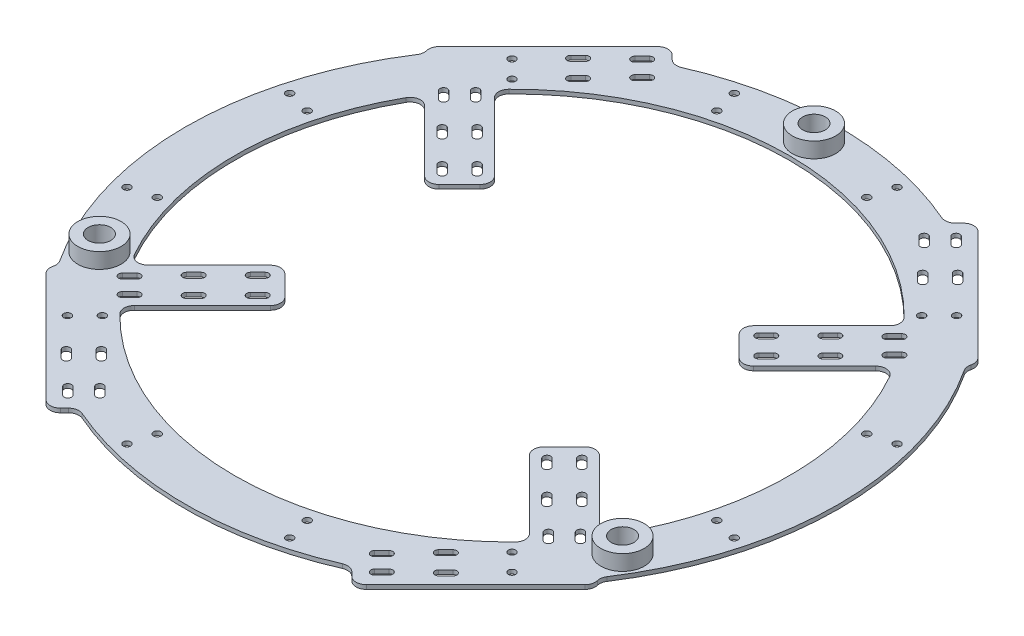
from build123d import *

# Parameters (mm, degrees)
SKETCH1_R            = 158.646968374
SKETCH1_R_2          = 5.5
SKETCH1_R_3          = 134.646968374
BOSS_EXTRUDE1_DEPTH  = 2
SKETCH7_R            = 10.5
SKETCH7_R_2          = 5.5
BOSS_EXTRUDE3_DEPTH  = 7.5
CIRPATTERN2_COUNT    = 3
BOSS_EXTRUDE4_DEPTH  = 2
FILLET1_R            = 5
FILLET2_R            = 5
CUT_EXTRUDE2_DEPTH   = 369.049903554
MIRROR2_DEPTH        = 2
MIRROR2_2_DEPTH      = 2
MIRROR3_DEPTH        = 2
MIRROR3_2_DEPTH      = 2
M3_CLEARANCE_HOLE1_D = 3.6
CIRPATTERN1_COUNT    = 12


with BuildPart() as part:
    # Sketch1 → Boss-Extrude1 (new body)
    with BuildSketch(Plane(origin=(0, 0, 0), x_dir=(1, 0, 0), z_dir=(0, 1, 0))):
        with Locations(Location((127, 73.323484187, 0), (0, 0, 270))):
            Circle(SKETCH1_R)
        with Locations(Location((127, 219.970452561, 0), (0, 0, 270))):
            Circle(SKETCH1_R_2, mode=Mode.SUBTRACT)
        with Locations(Location((0, 0, 0), (0, 0, 270))):
            Circle(SKETCH1_R_2, mode=Mode.SUBTRACT)
        with Locations(Location((254, 0, 0), (0, 0, 270))):
            Circle(SKETCH1_R_2, mode=Mode.SUBTRACT)
        with Locations(Location((127, 73.323484187, 0), (0, 0, 270))):
            Circle(SKETCH1_R_3, mode=Mode.SUBTRACT)
    extrude(amount=BOSS_EXTRUDE1_DEPTH)

    # Sketch7 → Boss-Extrude3 (add)
    with BuildSketch(Plane(origin=(0, 2, 0), x_dir=(1, 0, 0), z_dir=(0, 1, 0))):
        with Locations(Location((0, 0, 0), (0, 0, 270))):
            Circle(SKETCH7_R)
        with Locations(Location((0, 0, 0), (0, 0, 270))):
            Circle(SKETCH7_R_2, mode=Mode.SUBTRACT)
    boss_extrude3 = extrude(amount=BOSS_EXTRUDE3_DEPTH)

    # CirPattern2: Boss-Extrude3 ×3 about axis
    cirpattern2_axis = Axis((127, 0, -73.323484187), (0, 1, 0))
    for i in range(1, CIRPATTERN2_COUNT):
        add(boss_extrude3.rotate(cirpattern2_axis, i * 360 / CIRPATTERN2_COUNT))

    # Sketch10 → Boss-Extrude4 (add)
    with BuildSketch(Plane(origin=(0, 0, 0), x_dir=(1, 0, 0), z_dir=(0, 1, 0))):
        Polygon((203.367532368, 39.38235869), (261.350288425, -18.600397367), (201.246212025, -78.704473768), (187.104076401, -64.562338144), (230.237590053, -21.428824492), (186.39696962, 22.411795942), align=None)
    extrude(amount=BOSS_EXTRUDE4_DEPTH)

    # Fillet1
    # the kernel refuses this fillet: 5 mm, written as the material it adds along each edge
    with BuildSketch(Plane(origin=(226.357850019, 2, 17.549084457), x_dir=(-0.6883802582213798, 0, 0.7253499983394681), z_dir=(0, -1, 0))) as fillet1_piece_1:
        with BuildLine():
            CenterArc((4.870979082, 4.999150751), FILLET1_R, 181.497971358, 89.558058716)
            Line((-0.127312174, 4.868442981), (0, 0))
            ThreePointArc((0, 0), (2.481564937, -0.022869759), (4.963129874, 0))
        make_face()
    extrude(amount=2)
    with BuildSketch(Plane(origin=(241.02970545, 2, -1.720185608), x_dir=(0.51102345933338, 0, -0.8595667653015356), z_dir=(0, -1, 0))) as fillet1_piece_2:
        with BuildLine():
            CenterArc((6.43027238, -4.998519908), FILLET1_R, 88.605855923, 105.66211815)
            Line((1.58450417, -6.230806584), (0, 0))
            ThreePointArc((0, 0), (3.275961198, 0.039857973), (6.551922397, 0))
        make_face()
    extrude(amount=2)
    with BuildSketch(Plane(origin=(193.332367277, 2, 70.790629021), x_dir=(-0.9128099858809857, 0, 0.4083845365289371), z_dir=(0, -1, 0))) as fillet1_piece_3:
        with BuildLine():
            CenterArc((3.443160277, -4.99971466), FILLET1_R, 90.612119194, 68.491275043)
            Line((-1.227967753, -3.216301381), (0, 0))
            ThreePointArc((0, 0), (1.694871908, -0.009053664), (3.389743816, 0))
        make_face()
    extrude(amount=2)
    # the kernel refuses this fillet: 5 mm, written as the material it takes off along each edge
    with BuildSketch(Plane(origin=(261.350288425, -12.345117268, 18.600397367), x_dir=(-0.7071067811866127, 0, -0.7071067811864822), z_dir=(0, 1, 0))) as fillet1_2_piece_1:
        with BuildLine():
            CenterArc((5, 4.938046907), FILLET1_R, 180, 80.971126316)
            Line((0, 4.938046907), (0, 0))
            Line((0, 0), (4.215339092, 0))
        make_face()
    extrude(amount=26.690234537, mode=Mode.SUBTRACT)
    with BuildSketch(Plane(origin=(201.246212025, -12.5, 78.704473768), x_dir=(-0.7071067811865476, 0, -0.7071067811865476), z_dir=(0, 1, 0)), Plane(origin=(203.367532368, -12.5, -39.38235869), x_dir=(0.707106781186544, 0, 0.7071067811865511), z_dir=(0, 1, 0)), Plane(origin=(186.39696962, -12.5, -22.411795942), x_dir=(0.7071067811865521, 0, -0.7071067811865429), z_dir=(0, 1, 0))) as fillet1_2_piece_2:
        with BuildLine():
            CenterArc((FILLET1_R, -FILLET1_R), FILLET1_R, 90, 90)
            Line((0, -FILLET1_R), (0, 0))
            Line((0, 0), (FILLET1_R, 0))
        make_face()
    extrude(amount=27, mode=Mode.SUBTRACT)

    # Fillet2
    fillet2_edges = [part.edges().sort_by_distance(p)[0] for p in [
        (258.369593569, 1, 15.61970251),
    ]]
    fillet(fillet2_edges, radius=FILLET2_R)

    # Sketch11 → Cut-Extrude2 (cut, through all)
    with BuildSketch(Plane(origin=(0, 2, 0), x_dir=(1, 0, 0), z_dir=(0, 1, 0))):
        with BuildLine():
            Line((205.206009999, 31.604184097), (208.741543905, 28.068650191))
            ThreePointArc((208.741543905, 28.068650191), (208.741543905, 25.523065779), (206.195959493, 25.523065779))
            Line((206.195959493, 25.523065779), (202.660425587, 29.058599685))
            ThreePointArc((202.660425587, 29.058599685), (202.660425587, 31.604184097), (205.206009999, 31.604184097))
        make_face()
        with BuildLine():
            Line((196.720728625, 23.118902723), (200.256262531, 19.583368817))
            ThreePointArc((200.256262531, 19.583368817), (200.256262531, 17.037784405), (197.710678119, 17.037784405))
            Line((197.710678119, 17.037784405), (194.175144213, 20.573318311))
            ThreePointArc((194.175144213, 20.573318311), (194.175144213, 23.118902723), (196.720728625, 23.118902723))
        make_face()
        with BuildLine():
            Line((213.691291373, -41.934921146), (210.155757468, -45.470455052))
            ThreePointArc((210.155757468, -45.470455052), (207.610173055, -45.470455052), (207.610173055, -42.92487064))
            Line((207.610173055, -42.92487064), (211.145706961, -39.389336734))
            ThreePointArc((211.145706961, -39.389336734), (213.691291373, -39.389336734), (213.691291373, -41.934921146))
        make_face()
        with BuildLine():
            Line((222.176572748, -50.420202521), (218.641038842, -53.955736426))
            ThreePointArc((218.641038842, -53.955736426), (216.09545443, -53.955736426), (216.09545443, -51.410152014))
            Line((216.09545443, -51.410152014), (219.630988335, -47.874618108))
            ThreePointArc((219.630988335, -47.874618108), (222.176572748, -47.874618108), (222.176572748, -50.420202521))
        make_face()
        with BuildLine():
            Line((213.267027305, 1.481435219), (209.731493399, 5.016969124))
            ThreePointArc((209.731493399, 5.016969124), (209.731493399, 7.562553537), (212.277077811, 7.562553537))
            Line((212.277077811, 7.562553537), (215.812611717, 4.027019631))
            ThreePointArc((215.812611717, 4.027019631), (215.812611717, 1.481435219), (213.267027305, 1.481435219))
        make_face()
        with BuildLine():
            Line((221.752308679, 9.966716593), (218.216774773, 13.502250499))
            ThreePointArc((218.216774773, 13.502250499), (218.216774773, 16.047834911), (220.762359185, 16.047834911))
            Line((220.762359185, 16.047834911), (224.297893091, 12.512301005))
            ThreePointArc((224.297893091, 12.512301005), (224.297893091, 9.966716593), (221.752308679, 9.966716593))
        make_face()
        with BuildLine():
            Line((229.176929881, -13.721360577), (225.641395976, -10.185826671))
            ThreePointArc((225.641395976, -10.185826671), (225.641395976, -7.640242259), (228.186980388, -7.640242259))
            Line((228.186980388, -7.640242259), (231.722514294, -11.175776165))
            ThreePointArc((231.722514294, -11.175776165), (231.722514294, -13.721360577), (229.176929881, -13.721360577))
        make_face()
        with BuildLine():
            Line((236.955104475, -5.943185984), (233.419570569, -2.407652078))
            ThreePointArc((233.419570569, -2.407652078), (233.419570569, 0.137932334), (235.965154981, 0.137932334))
            Line((235.965154981, 0.137932334), (239.500688887, -3.397601572))
            ThreePointArc((239.500688887, -3.397601572), (239.500688887, -5.943185984), (236.955104475, -5.943185984))
        make_face()
        with BuildLine():
            Line((200.185551853, -66.61294781), (203.721085759, -63.077413904))
            ThreePointArc((203.721085759, -63.077413904), (206.266670171, -63.077413904), (206.266670171, -65.622998316))
            Line((206.266670171, -65.622998316), (202.731136265, -69.158532222))
            ThreePointArc((202.731136265, -69.158532222), (200.185551853, -69.158532222), (200.185551853, -66.61294781))
        make_face()
        with BuildLine():
            Line((192.40737726, -58.834773217), (195.942911166, -55.299239311))
            ThreePointArc((195.942911166, -55.299239311), (198.488495578, -55.299239311), (198.488495578, -57.844823723))
            Line((198.488495578, -57.844823723), (194.952961672, -61.380357629))
            ThreePointArc((194.952961672, -61.380357629), (192.40737726, -61.380357629), (192.40737726, -58.834773217))
        make_face()
    extrude(amount=-CUT_EXTRUDE2_DEPTH, mode=Mode.SUBTRACT)

    # Mirror2: read off the stored shape, not the designer's step
    # Mirror2 outline → Mirror2 (cut)
    with BuildSketch(Plane(origin=(0, 0, 0), x_dir=(1, 0, 0), z_dir=(0, 1, 0))):
        with BuildLine():
            ThreePointArc((22.218345726, -11.237801403), (22.16461143, -13.59744974), (24.493379958, -13.981721505))
            ThreePointArc((24.493379958, -13.981721505), (23.346782773, -12.617289905), (22.218345726, -11.237801403))
        make_face()
        with BuildLine():
            ThreePointArc((17.690586916, -5.297494593), (16.633247552, -3.806186157), (15.596252703, -2.300659982))
            Line((15.596252703, -2.300659982), (14.499311113, -3.397601572))
            ThreePointArc((14.499311113, -3.397601572), (14.499311113, -5.943185984), (17.044895525, -5.943185984))
            Line((17.044895525, -5.943185984), (17.690586916, -5.297494593))
        make_face()
        with BuildLine():
            ThreePointArc((47.280172548, -63.839228257), (50.781748641, -65.815434645), (54.332281132, -67.70226952))
            ThreePointArc((54.332281132, -67.70226952), (54.167321031, -67.112944432), (53.814448147, -66.61294781))
            Line((53.814448147, -66.61294781), (50.278914241, -63.077413904))
            ThreePointArc((50.278914241, -63.077413904), (48.562919872, -62.605622537), (47.280172548, -63.839228257))
        make_face()
        with BuildLine():
            Line((46.389826945, -42.92487064), (42.854293039, -39.389336734))
            ThreePointArc((42.854293039, -39.389336734), (40.308708627, -39.389336734), (40.308708627, -41.934921146))
            Line((40.308708627, -41.934921146), (43.844242532, -45.470455052))
            ThreePointArc((43.844242532, -45.470455052), (46.389826945, -45.470455053), (46.389826945, -42.92487064))
        make_face()
        with BuildLine():
            Line((37.90454557, -51.410152014), (34.369011665, -47.874618108))
            ThreePointArc((34.369011665, -47.874618108), (31.823427252, -47.874618108), (31.823427252, -50.420202521))
            Line((31.823427252, -50.420202521), (35.358961158, -53.955736426))
            ThreePointArc((35.358961158, -53.955736426), (37.90454557, -53.955736426), (37.90454557, -51.410152014))
        make_face()
        with BuildLine():
            Line((55.511504422, -57.844823723), (59.047038328, -61.380357629))
            ThreePointArc((59.047038328, -61.380357629), (61.59262274, -61.380357629), (61.59262274, -58.834773217))
            Line((61.59262274, -58.834773217), (58.057088834, -55.299239311))
            ThreePointArc((58.057088834, -55.299239311), (55.511504422, -55.299239311), (55.511504422, -57.844823723))
        make_face()
    extrude(amount=MIRROR2_DEPTH, mode=Mode.SUBTRACT)

    # Mirror2 2 outline → Mirror2 2 (add)
    # profile 1 of 2: a face of its own
    with BuildSketch(Plane(origin=(0, 0, 0), x_dir=(1, 0, 0), z_dir=(0, 1, 0))):
        with BuildLine():
            ThreePointArc((64.067496474, 18.876262036), (65.531962568, 22.411795942), (64.067496474, 25.947329848))
            Line((64.067496474, 25.947329848), (54.168001538, 35.846824784))
            ThreePointArc((54.168001538, 35.846824784), (50.632467632, 37.311290878), (47.096933726, 35.846824784))
            Line((47.096933726, 35.846824784), (17.516370009, 6.266261067))
            ThreePointArc((17.516370009, 6.266261067), (13.299573002, 4.848424344), (9.622108502, 7.35200035))
            ThreePointArc((9.622108502, 7.35200035), (12.507410608, 2.462683546), (15.596252703, -2.300659982))
            Line((15.596252703, -2.300659982), (18.034845019, 0.137932334))
            ThreePointArc((18.034845019, 0.137932334), (20.580429431, 0.137932334), (20.580429431, -2.407652078))
            Line((20.580429431, -2.407652078), (17.690586916, -5.297494593))
            ThreePointArc((17.690586916, -5.297494593), (19.913268366, -8.299049474), (22.218345726, -11.237801403))
            ThreePointArc((22.218345726, -11.237801403), (22.247546523, -11.206436765), (22.277485706, -11.175776165))
            Line((22.277485706, -11.175776165), (25.813019612, -7.640242259))
            ThreePointArc((25.813019612, -7.640242259), (28.358604024, -7.640242259), (28.358604024, -10.185826671))
            Line((28.358604024, -10.185826671), (24.823070119, -13.721360577))
            ThreePointArc((24.823070119, -13.721360577), (24.665846731, -13.861192246), (24.493379958, -13.981721505))
            ThreePointArc((24.493379958, -13.981721505), (27.711330181, -17.62466664), (31.058670603, -21.149090705))
            ThreePointArc((31.058670603, -21.149090705), (29.621406993, -17.621649163), (31.085835903, -14.105398536))
            Line((31.085835903, -14.105398536), (64.067496474, 18.876262036))
        make_face()
        with BuildLine():
            ThreePointArc((41.722922189, 7.562553537), (44.268506602, 7.562553536), (44.268506601, 5.016969124))
            Line((44.268506601, 5.016969124), (40.732972695, 1.481435219))
            ThreePointArc((40.732972695, 1.481435219), (38.187388283, 1.481435219), (38.187388283, 4.027019631))
            Line((38.187388283, 4.027019631), (41.722922189, 7.562553537))
        make_face(mode=Mode.SUBTRACT)
        with BuildLine():
            ThreePointArc((32.247691321, 9.966716593), (29.702106909, 9.966716593), (29.702106909, 12.512301005))
            Line((29.702106909, 12.512301005), (33.237640815, 16.047834911))
            ThreePointArc((33.237640815, 16.047834911), (35.783225227, 16.047834911), (35.783225227, 13.502250499))
            Line((35.783225227, 13.502250499), (32.247691321, 9.966716593))
        make_face(mode=Mode.SUBTRACT)
        with BuildLine():
            ThreePointArc((57.279271375, 23.118902723), (59.824855787, 23.118902723), (59.824855787, 20.573318311))
            Line((59.824855787, 20.573318311), (56.289321881, 17.037784405))
            ThreePointArc((56.289321881, 17.037784405), (53.743737469, 17.037784405), (53.743737469, 19.583368817))
            Line((53.743737469, 19.583368817), (57.279271375, 23.118902723))
        make_face(mode=Mode.SUBTRACT)
        with BuildLine():
            ThreePointArc((47.804040507, 25.523065779), (45.258456095, 25.523065779), (45.258456095, 28.068650191))
            Line((45.258456095, 28.068650191), (48.793990001, 31.604184097))
            ThreePointArc((48.793990001, 31.604184097), (51.339574413, 31.604184097), (51.339574413, 29.058599685))
            Line((51.339574413, 29.058599685), (47.804040507, 25.523065779))
        make_face(mode=Mode.SUBTRACT)
    # profile 2 of 2: a face of its own
    with BuildSketch(Plane(origin=(0, 0, 0), x_dir=(1, 0, 0), z_dir=(0, 1, 0))):
        with BuildLine():
            ThreePointArc((49.218254069, -75.168939862), (52.753787975, -76.633405956), (56.289321881, -75.168939862))
            Line((56.289321881, -75.168939862), (58.233243746, -73.225017997))
            ThreePointArc((58.233243746, -73.225017997), (60.835783458, -71.848370938), (63.761824728, -72.174947978))
            ThreePointArc((63.761824728, -72.174947978), (59.0102638, -70.016169592), (54.332281132, -67.70226952))
            ThreePointArc((54.332281132, -67.70226952), (53.314451525, -69.511405106), (51.268863735, -69.158532222))
            Line((51.268863735, -69.158532222), (47.733329829, -65.622998316))
            ThreePointArc((47.733329829, -65.622998316), (47.261538462, -64.793408273), (47.280172548, -63.839228257))
            ThreePointArc((47.280172548, -63.839228257), (17.769585658, -41.731186108), (-5.840294317, -13.407806474))
            ThreePointArc((-5.840294317, -13.407806474), (-5.096712491, -15.309000124), (-5.174992941, -17.348932327))
            ThreePointArc((-5.174992941, -17.348932327), (-5.140911453, -19.893750961), (-3.858561971, -22.092123821))
            Line((-3.858561971, -22.092123821), (49.218254069, -75.168939862))
        make_face()
    extrude(amount=MIRROR2_2_DEPTH)

    # Mirror3: read off the stored shape, not the designer's step
    # Mirror3 outline → Mirror3 (cut)
    with BuildSketch(Plane(origin=(0, 0, 0), x_dir=(1, 0, 0), z_dir=(0, 1, 0))):
        with BuildLine():
            ThreePointArc((22.218345728, 157.884769775), (23.346782775, 159.264258277), (24.493379961, 160.628689877))
            ThreePointArc((24.493379961, 160.628689877), (22.16461143, 160.244418114), (22.218345728, 157.884769775))
        make_face()
        with BuildLine():
            Line((14.499311113, 150.044569946), (15.596252705, 148.947628354))
            ThreePointArc((15.596252705, 148.947628354), (16.633247555, 150.453154529), (17.690586918, 151.944462965))
            Line((17.690586918, 151.944462965), (17.044895525, 152.590154358))
            ThreePointArc((17.044895525, 152.590154358), (14.499311113, 152.590154358), (14.499311113, 150.044569946))
        make_face()
        with BuildLine():
            ThreePointArc((231.781654272, 157.884769775), (231.83538857, 160.244418114), (229.506620039, 160.628689877))
            ThreePointArc((229.506620039, 160.628689877), (230.653217225, 159.264258277), (231.781654272, 157.884769775))
        make_face()
        with BuildLine():
            Line((236.955104475, 152.590154358), (236.309413082, 151.944462965))
            ThreePointArc((236.309413082, 151.944462965), (237.366752445, 150.453154529), (238.403747295, 148.947628354))
            Line((238.403747295, 148.947628354), (239.500688887, 150.044569946))
            ThreePointArc((239.500688887, 150.044569946), (239.500688887, 152.590154358), (236.955104475, 152.590154358))
        make_face()
        with BuildLine():
            ThreePointArc((53.814448147, 213.259916184), (54.167321031, 213.759912806), (54.332281133, 214.349237895))
            ThreePointArc((54.332281133, 214.349237895), (50.78174864, 212.46240302), (47.280172547, 210.486196632))
            ThreePointArc((47.280172547, 210.486196632), (48.562919871, 209.252590911), (50.278914241, 209.724382278))
            Line((50.278914241, 209.724382278), (53.814448147, 213.259916184))
        make_face()
        with BuildLine():
            ThreePointArc((206.719827453, 210.486196632), (203.21825136, 212.46240302), (199.667718867, 214.349237895))
            ThreePointArc((199.667718867, 214.349237895), (199.832678969, 213.759912806), (200.185551853, 213.259916184))
            Line((200.185551853, 213.259916184), (203.721085759, 209.724382278))
            ThreePointArc((203.721085759, 209.724382278), (205.437080129, 209.252590911), (206.719827453, 210.486196632))
        make_face()
        with BuildLine():
            Line((43.844242532, 192.117423426), (40.308708627, 188.58188952))
            ThreePointArc((40.308708627, 188.58188952), (40.308708627, 186.036305108), (42.854293039, 186.036305108))
            Line((42.854293039, 186.036305108), (46.389826945, 189.571839014))
            ThreePointArc((46.389826945, 189.571839014), (46.389826944, 192.117423427), (43.844242532, 192.117423426))
        make_face()
        with BuildLine():
            Line((35.358961158, 200.602704801), (31.823427252, 197.067170895))
            ThreePointArc((31.823427252, 197.067170895), (31.823427252, 194.521586482), (34.369011665, 194.521586482))
            Line((34.369011665, 194.521586482), (37.90454557, 198.057120388))
            ThreePointArc((37.90454557, 198.057120388), (37.904545571, 200.6027048), (35.358961158, 200.602704801))
        make_face()
        with BuildLine():
            Line((58.057088834, 201.946207685), (61.59262274, 205.481741591))
            ThreePointArc((61.59262274, 205.481741591), (61.59262274, 208.027326003), (59.047038328, 208.027326003))
            Line((59.047038328, 208.027326003), (55.511504422, 204.491792097))
            ThreePointArc((55.511504422, 204.491792097), (55.511504422, 201.946207685), (58.057088834, 201.946207685))
        make_face()
        with BuildLine():
            Line((207.610173055, 189.571839014), (211.145706961, 186.036305108))
            ThreePointArc((211.145706961, 186.036305108), (213.691291373, 186.036305108), (213.691291373, 188.58188952))
            Line((213.691291373, 188.58188952), (210.155757468, 192.117423426))
            ThreePointArc((210.155757468, 192.117423426), (207.610173055, 192.117423426), (207.610173055, 189.571839014))
        make_face()
        with BuildLine():
            Line((216.09545443, 198.057120388), (219.630988335, 194.521586482))
            ThreePointArc((219.630988335, 194.521586482), (222.176572748, 194.521586482), (222.176572748, 197.067170895))
            Line((222.176572748, 197.067170895), (218.641038842, 200.602704801))
            ThreePointArc((218.641038842, 200.602704801), (216.095454429, 200.6027048), (216.09545443, 198.057120388))
        make_face()
        with BuildLine():
            Line((198.488495578, 204.491792097), (194.952961672, 208.027326003))
            ThreePointArc((194.952961672, 208.027326003), (192.40737726, 208.027326003), (192.40737726, 205.481741591))
            Line((192.40737726, 205.481741591), (195.942911166, 201.946207685))
            ThreePointArc((195.942911166, 201.946207685), (198.488495578, 201.946207685), (198.488495578, 204.491792097))
        make_face()
    extrude(amount=MIRROR3_DEPTH, mode=Mode.SUBTRACT)

    # Mirror3 2 outline → Mirror3 2 (add)
    # profile 1 of 4: a face of its own
    with BuildSketch(Plane(origin=(0, 0, 0), x_dir=(1, 0, 0), z_dir=(0, 1, 0))):
        with BuildLine():
            ThreePointArc((229.506620039, 160.628689877), (226.288669816, 164.271635012), (222.941329395, 167.796059077))
            ThreePointArc((222.941329395, 167.796059077), (224.378593007, 164.268617537), (222.914164097, 160.75236691))
            Line((222.914164097, 160.75236691), (189.932503526, 127.770706338))
            ThreePointArc((189.932503526, 127.770706338), (188.468037432, 124.235172432), (189.932503526, 120.699638527))
            Line((189.932503526, 120.699638527), (199.831998462, 110.80014359))
            ThreePointArc((199.831998462, 110.80014359), (203.367532368, 109.335677496), (206.903066274, 110.80014359))
            Line((206.903066274, 110.80014359), (236.483629991, 140.380707307))
            ThreePointArc((236.483629991, 140.380707307), (240.700426997, 141.79854403), (244.377891498, 139.294968025))
            ThreePointArc((244.377891498, 139.294968025), (241.492589389, 144.184284826), (238.403747295, 148.947628354))
            Line((238.403747295, 148.947628354), (235.965154981, 146.50903604))
            ThreePointArc((235.965154981, 146.50903604), (233.419570569, 146.50903604), (233.419570569, 149.054620452))
            Line((233.419570569, 149.054620452), (236.309413082, 151.944462965))
            ThreePointArc((236.309413082, 151.944462965), (234.086731631, 154.946017846), (231.781654272, 157.884769775))
            ThreePointArc((231.781654272, 157.884769775), (231.752453476, 157.853405138), (231.722514294, 157.822744539))
            Line((231.722514294, 157.822744539), (228.186980388, 154.287210633))
            ThreePointArc((228.186980388, 154.287210633), (225.641395976, 154.287210633), (225.641395976, 156.832795045))
            Line((225.641395976, 156.832795045), (229.176929881, 160.368328951))
            ThreePointArc((229.176929881, 160.368328951), (229.334153268, 160.508160619), (229.506620039, 160.628689877))
        make_face()
        with BuildLine():
            ThreePointArc((206.195959493, 121.123902595), (208.741543905, 121.123902595), (208.741543905, 118.578318183))
            Line((208.741543905, 118.578318183), (205.206009999, 115.042784277))
            ThreePointArc((205.206009999, 115.042784277), (202.660425587, 115.042784277), (202.660425587, 117.588368689))
            Line((202.660425587, 117.588368689), (206.195959493, 121.123902595))
        make_face(mode=Mode.SUBTRACT)
        with BuildLine():
            ThreePointArc((196.720728625, 123.528065651), (194.175144213, 123.528065652), (194.175144213, 126.073650064))
            Line((194.175144213, 126.073650064), (197.710678119, 129.60918397))
            ThreePointArc((197.710678119, 129.60918397), (200.256262531, 129.60918397), (200.256262531, 127.063599557))
            Line((200.256262531, 127.063599557), (196.720728625, 123.528065651))
        make_face(mode=Mode.SUBTRACT)
        with BuildLine():
            ThreePointArc((221.752308679, 136.680251781), (224.297893091, 136.680251781), (224.297893091, 134.134667369))
            Line((224.297893091, 134.134667369), (220.762359185, 130.599133463))
            ThreePointArc((220.762359185, 130.599133463), (218.216774773, 130.599133463), (218.216774773, 133.144717875))
            Line((218.216774773, 133.144717875), (221.752308679, 136.680251781))
        make_face(mode=Mode.SUBTRACT)
        with BuildLine():
            ThreePointArc((212.277077811, 139.084414837), (209.731493398, 139.084414837), (209.731493399, 141.62999925))
            Line((209.731493399, 141.62999925), (213.267027305, 145.165533156))
            ThreePointArc((213.267027305, 145.165533156), (215.812611718, 145.165533156), (215.812611717, 142.619948743))
            Line((215.812611717, 142.619948743), (212.277077811, 139.084414837))
        make_face(mode=Mode.SUBTRACT)
    # profile 2 of 4: a face of its own
    with BuildSketch(Plane(origin=(0, 0, 0), x_dir=(1, 0, 0), z_dir=(0, 1, 0))):
        with BuildLine():
            Line((54.168001538, 110.80014359), (64.067496474, 120.699638527))
            ThreePointArc((64.067496474, 120.699638527), (65.531962568, 124.235172432), (64.067496474, 127.770706338))
            Line((64.067496474, 127.770706338), (31.085835903, 160.75236691))
            ThreePointArc((31.085835903, 160.75236691), (29.621406993, 164.268617537), (31.058670605, 167.796059077))
            ThreePointArc((31.058670605, 167.796059077), (27.711330184, 164.271635012), (24.493379961, 160.628689877))
            ThreePointArc((24.493379961, 160.628689877), (24.665846732, 160.508160619), (24.823070119, 160.368328951))
            Line((24.823070119, 160.368328951), (28.358604024, 156.832795045))
            ThreePointArc((28.358604024, 156.832795045), (28.358604024, 154.287210633), (25.813019612, 154.287210633))
            Line((25.813019612, 154.287210633), (22.277485706, 157.822744539))
            ThreePointArc((22.277485706, 157.822744539), (22.247546524, 157.853405138), (22.218345728, 157.884769775))
            ThreePointArc((22.218345728, 157.884769775), (19.913268369, 154.946017846), (17.690586918, 151.944462965))
            Line((17.690586918, 151.944462965), (20.580429431, 149.054620452))
            ThreePointArc((20.580429431, 149.054620452), (20.580429431, 146.50903604), (18.034845019, 146.50903604))
            Line((18.034845019, 146.50903604), (15.596252705, 148.947628354))
            ThreePointArc((15.596252705, 148.947628354), (12.507410611, 144.184284826), (9.622108502, 139.294968025))
            ThreePointArc((9.622108502, 139.294968025), (13.299573003, 141.79854403), (17.516370009, 140.380707307))
            Line((17.516370009, 140.380707307), (47.096933726, 110.80014359))
            ThreePointArc((47.096933726, 110.80014359), (50.632467632, 109.335677496), (54.168001538, 110.80014359))
        make_face()
        with BuildLine():
            Line((47.804040507, 121.123902595), (51.339574413, 117.588368689))
            ThreePointArc((51.339574413, 117.588368689), (51.339574413, 115.042784277), (48.793990001, 115.042784277))
            Line((48.793990001, 115.042784277), (45.258456095, 118.578318183))
            ThreePointArc((45.258456095, 118.578318183), (45.258456095, 121.123902595), (47.804040507, 121.123902595))
        make_face(mode=Mode.SUBTRACT)
        with BuildLine():
            ThreePointArc((59.824855787, 126.073650064), (59.824855787, 123.528065652), (57.279271375, 123.528065651))
            Line((57.279271375, 123.528065651), (53.743737469, 127.063599557))
            ThreePointArc((53.743737469, 127.063599557), (53.743737469, 129.609183969), (56.289321881, 129.60918397))
            Line((56.289321881, 129.60918397), (59.824855787, 126.073650064))
        make_face(mode=Mode.SUBTRACT)
        with BuildLine():
            ThreePointArc((29.702106909, 134.134667369), (29.702106909, 136.680251781), (32.247691321, 136.680251781))
            Line((32.247691321, 136.680251781), (35.783225227, 133.144717875))
            ThreePointArc((35.783225227, 133.144717875), (35.783225227, 130.599133463), (33.237640815, 130.599133463))
            Line((33.237640815, 130.599133463), (29.702106909, 134.134667369))
        make_face(mode=Mode.SUBTRACT)
        with BuildLine():
            Line((41.722922189, 139.084414837), (38.187388283, 142.619948743))
            ThreePointArc((38.187388283, 142.619948743), (38.187388282, 145.165533156), (40.732972695, 145.165533156))
            Line((40.732972695, 145.165533156), (44.268506601, 141.62999925))
            ThreePointArc((44.268506601, 141.62999925), (44.268506602, 139.084414838), (41.722922189, 139.084414837))
        make_face(mode=Mode.SUBTRACT)
    # profile 3 of 4: a face of its own
    with BuildSketch(Plane(origin=(0, 0, 0), x_dir=(1, 0, 0), z_dir=(0, 1, 0))):
        with BuildLine():
            ThreePointArc((195.766756254, 219.871986371), (193.164216542, 218.495339312), (190.238175272, 218.821916352))
            ThreePointArc((190.238175272, 218.821916352), (194.9897362, 216.663137967), (199.667718867, 214.349237895))
            ThreePointArc((199.667718867, 214.349237895), (200.685548475, 216.15837348), (202.731136265, 215.805500596))
            Line((202.731136265, 215.805500596), (206.266670171, 212.26996669))
            ThreePointArc((206.266670171, 212.26996669), (206.738461538, 211.440376648), (206.719827453, 210.486196632))
            ThreePointArc((206.719827453, 210.486196632), (236.230414343, 188.378154482), (259.840294318, 160.054774849))
            ThreePointArc((259.840294318, 160.054774849), (259.096712491, 161.955968498), (259.174992941, 163.995900701))
            ThreePointArc((259.174992941, 163.995900701), (259.140911453, 166.540719335), (257.858561971, 168.739092195))
            Line((257.858561971, 168.739092195), (204.781745931, 221.815908236))
            ThreePointArc((204.781745931, 221.815908236), (201.246212025, 223.28037433), (197.710678119, 221.815908236))
            Line((197.710678119, 221.815908236), (195.766756254, 219.871986371))
        make_face()
    # profile 4 of 4: a face of its own
    with BuildSketch(Plane(origin=(0, 0, 0), x_dir=(1, 0, 0), z_dir=(0, 1, 0))):
        with BuildLine():
            Line((58.233243746, 219.871986371), (56.289321881, 221.815908236))
            ThreePointArc((56.289321881, 221.815908236), (52.753787975, 223.28037433), (49.218254069, 221.815908236))
            Line((49.218254069, 221.815908236), (-3.858561971, 168.739092195))
            ThreePointArc((-3.858561971, 168.739092195), (-5.140911453, 166.540719335), (-5.174992941, 163.995900701))
            ThreePointArc((-5.174992941, 163.995900701), (-5.096712491, 161.955968498), (-5.840294318, 160.054774849))
            ThreePointArc((-5.840294318, 160.054774849), (17.769585657, 188.378154482), (47.280172547, 210.486196632))
            ThreePointArc((47.280172547, 210.486196632), (47.261538462, 211.440376648), (47.733329829, 212.26996669))
            Line((47.733329829, 212.26996669), (51.268863735, 215.805500596))
            ThreePointArc((51.268863735, 215.805500596), (53.314451525, 216.15837348), (54.332281133, 214.349237895))
            ThreePointArc((54.332281133, 214.349237895), (59.0102638, 216.663137967), (63.761824728, 218.821916352))
            ThreePointArc((63.761824728, 218.821916352), (60.835783458, 218.495339312), (58.233243746, 219.871986371))
        make_face()
    extrude(amount=MIRROR3_2_DEPTH)

    # M3 Clearance Hole1 (through all)
    with Locations(Plane(origin=(0, 2, 0), x_dir=(1, 0, 0), z_dir=(0, 1, 0))):
        with Locations((-20.445649057, 33.815541595), (-8.854539142, 36.921370136)):
            m3_clearance_hole1 = Hole(M3_CLEARANCE_HOLE1_D / 2)

    # CirPattern1: M3 Clearance Hole1 ×12 about axis
    cirpattern1_axis = Axis((127, 0, -73.323484187), (0, 1, 0))
    for i in range(1, CIRPATTERN1_COUNT):
        add(m3_clearance_hole1.rotate(cirpattern1_axis, i * 360 / CIRPATTERN1_COUNT), mode=Mode.SUBTRACT)


solid = part.part
